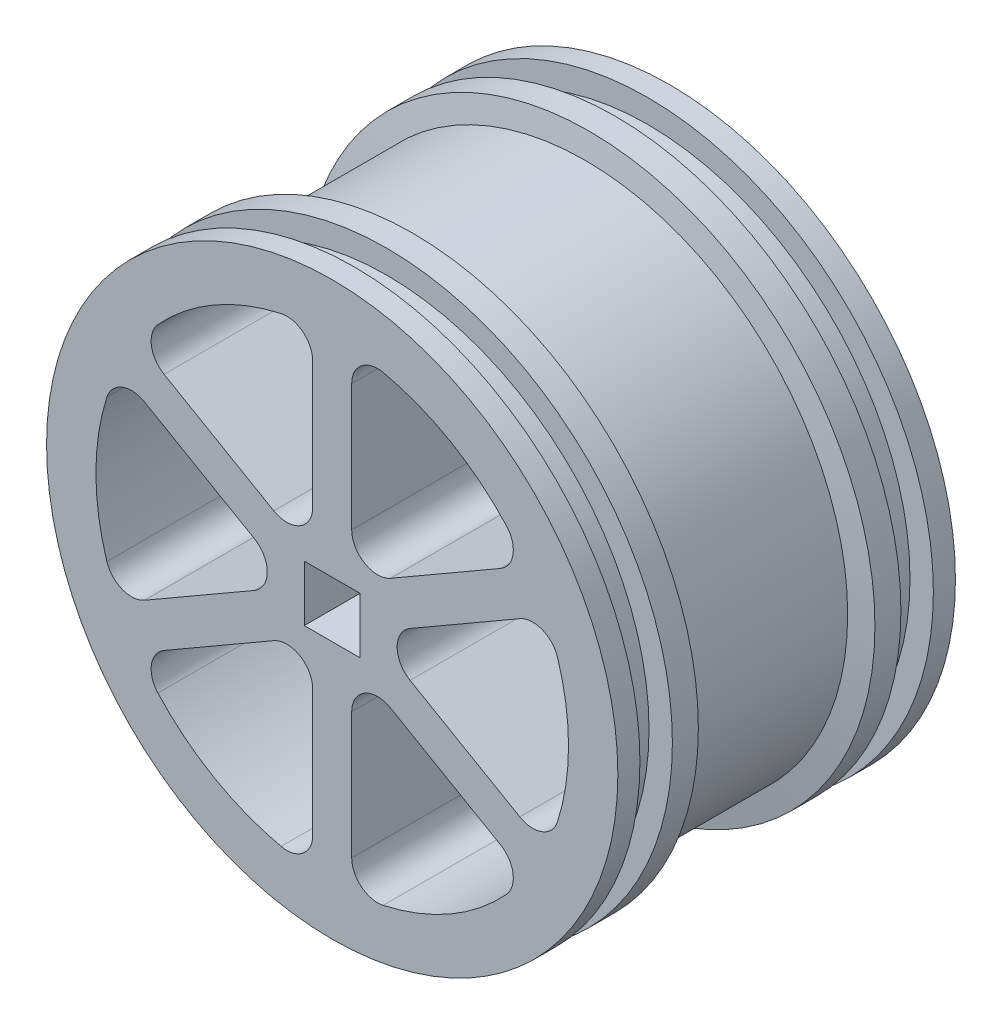
from build123d import *

# Parameters (mm, degrees)
SKETCH2_W               = 3
SKETCH2_H               = 18.2
BOSS_EXTRUDE1_DEPTH     = 24
CIRPATTERN1_COUNT       = 6
CUT_EXTRUDE1_DEPTH      = 41.546269865
CUT_EXTRUDE1_DEPTH_BACK = 41.546269865
SKETCH3_W               = 4.3
SKETCH3_H               = 4.3
FILLET1_R               = 2
FILLET2_R               = 2


with BuildPart() as part:
    # Sketch1 → Revolve1 (revolve)
    with BuildSketch(Plane(origin=(0, 0, 0), x_dir=(0, 0, -1), z_dir=(1, 0, 0)), mode=Mode.PRIVATE) as revolve1_sk:
        Polygon((0, 22), (1.7, 22), (1.7, 20.2), (4.2, 20.2), (4.2, 22), (6.2, 22), (6.5, 20.2), (19.5, 20.2), (19.8, 22), (21.8, 22), (21.8, 20.2), (24.3, 20.2), (24.3, 22), (26, 22), (26, 18.2), (0, 18.2), align=None)
    revolve(revolve1_sk.sketch.rotate(Axis((0, 0, 0.322174052), (0, 0, -1)), 90), axis=Axis((0, 0, 0.322174052), (0, 0, -1)))

    # Sketch2 → Boss-Extrude1 (add)
    with BuildSketch(Plane.XY):
        with Locations((0, 9.1)):
            Rectangle(SKETCH2_W, SKETCH2_H)
    boss_extrude1 = extrude(amount=-BOSS_EXTRUDE1_DEPTH)

    # CirPattern1: Boss-Extrude1 ×6 about axis
    cirpattern1_axis = Axis((0, 0, 0), (0, 0, 1))
    for i in range(1, CIRPATTERN1_COUNT):
        add(boss_extrude1.rotate(cirpattern1_axis, i * 360 / CIRPATTERN1_COUNT))

    # Sketch3 → Cut-Extrude1 (cut, two sides: drawn at the far end of the back side and taken through both)
    with BuildSketch(Plane.XY.offset(-CUT_EXTRUDE1_DEPTH_BACK)):
        Rectangle(SKETCH3_W, SKETCH3_H)
    extrude(amount=CUT_EXTRUDE1_DEPTH + CUT_EXTRUDE1_DEPTH_BACK, mode=Mode.SUBTRACT)

    # Fillet1
    fillet1_edges = [part.edges().sort_by_distance(p)[0] for p in [
        (14.958039343, 10.368078849, -12),
        (-14.958039343, 10.368078849, -12),
        (-1.5, 18.138081486, -12),
        (1.5, 18.138081486, -12),
        (-16.458039343, 7.770002637, -12),
        (-14.958039343, -10.368078849, -12),
        (-16.458039343, -7.770002637, -12),
        (1.5, -18.138081486, -12),
        (-1.5, -18.138081486, -12),
        (14.958039343, -10.368078849, -12),
        (16.458039343, -7.770002637, -12),
        (16.458039343, 7.770002637, -12),
        (3, 0, -12),
        (1.5, -2.598076211, -12),
        (-1.5, -2.598076211, -12),
        (-3, 0, -12),
        (1.5, 2.598076211, -12),
        (-1.5, 2.598076211, -12),
    ]]
    fillet(fillet1_edges, radius=FILLET1_R)

    # Fillet2
    fillet2_edges = [part.edges().sort_by_distance(p)[0] for p in [
        (-18.2, 0, -26),
    ]]
    fillet(fillet2_edges, radius=FILLET2_R - 0.0001)  # a hair under: the kernel refuses the full size


solid = part.part
